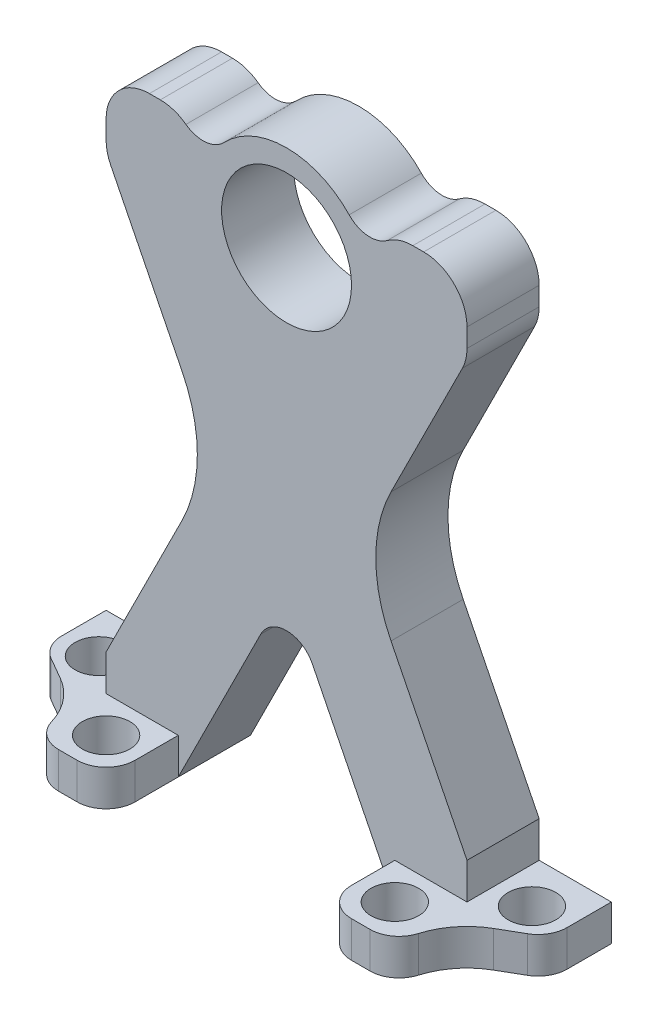
from build123d import *

# Parameters (mm, degrees)
SKETCH1_R           = 4.5
BOSS_EXTRUDE2_DEPTH = 5
SKETCH2_W           = 5
SKETCH2_H           = 2.5
BOSS_EXTRUDE3_DEPTH = 10
SKETCH3_W           = 10
SKETCH3_H           = 2.5
BOSS_EXTRUDE4_DEPTH = 5
SKETCH4_W           = 10
SKETCH4_H           = 2.5
BOSS_EXTRUDE5_DEPTH = 5
SKETCH5_R           = 1.65
CUT_EXTRUDE1_DEPTH  = 5
CHAMFER1_SIZE       = 5.773502692
CHAMFER1_SIZE_2     = 10
FILLET1_R           = 2
FILLET2_R           = 5
FILLET3_R           = 2
FILLET4_R           = 2
FILLET5_R           = 10
FILLET6_R           = 3
SKETCH6_R           = 1.65
SKETCH6_W           = 36.073404507
SKETCH6_H           = 7.954648173
CUT_EXTRUDE2_DEPTH  = 5
FILLET10_R          = 2


with BuildPart() as part:
    # Sketch1 → Boss-Extrude2 (new body)
    with BuildSketch(Plane.XY):
        with BuildLine():
            Line((-7.5, 20), (-5.870329309, 16.740658618))
            ThreePointArc((-5.870329309, 16.740658618), (0, 21.5), (5.870329309, 16.740658618))
            Line((5.870329309, 16.740658618), (7.5, 20))
            Line((7.5, 20), (12.5, 20))
            Line((12.5, 20), (12.5, 15))
            Line((12.5, 15), (5, 0))
            Line((5, 0), (12.5, -15))
            Line((12.5, -15), (12.5, -20))
            Line((12.5, -20), (7.5, -20))
            Line((7.5, -20), (0, -5))
            Line((0, -5), (-7.5, -20))
            Line((-7.5, -20), (-12.5, -20))
            Line((-12.5, -20), (-12.5, -15))
            Line((-12.5, -15), (-5, 0))
            Line((-5, 0), (-12.5, 15))
            Line((-12.5, 15), (-12.5, 20))
            Line((-12.5, 20), (-7.5, 20))
        make_face()
        with Locations((0, 15.5)):
            Circle(SKETCH1_R, mode=Mode.SUBTRACT)
    extrude(amount=BOSS_EXTRUDE2_DEPTH)

    # Sketch2 → Boss-Extrude3 (add)
    with BuildSketch(Plane.XY.offset(5)):
        with Locations((-10, -18.75)):
            Rectangle(SKETCH2_W, SKETCH2_H)
        with Locations((10, -18.75)):
            Rectangle(SKETCH2_W, SKETCH2_H)
    extrude(amount=BOSS_EXTRUDE3_DEPTH)

    # Sketch3 → Boss-Extrude4 (add)
    with BuildSketch(Plane(origin=(12.5, 0, 0), x_dir=(0, 0, -1), z_dir=(1, 0, 0))):
        with Locations((-5, -18.75)):
            Rectangle(SKETCH3_W, SKETCH3_H)
    extrude(amount=BOSS_EXTRUDE4_DEPTH)

    # Sketch4 → Boss-Extrude5 (add)
    with BuildSketch(Plane.ZY.offset(12.5)):
        with Locations((5, -18.75)):
            Rectangle(SKETCH4_W, SKETCH4_H)
    extrude(amount=BOSS_EXTRUDE5_DEPTH)

    # Sketch5 → Cut-Extrude1 (cut)
    with BuildSketch(Plane(origin=(0, -17.5, 0), x_dir=(1, 0, 0), z_dir=(0, 1, 0))):
        with Locations(Location((-15, -3, 0), (0, 0, 270))):
            Circle(SKETCH5_R)
        with Locations(Location((-10, -12, 0), (0, 0, 270))):
            Circle(SKETCH5_R)
        with Locations(Location((10, -12, 0), (0, 0, 270))):
            Circle(SKETCH5_R)
        with Locations(Location((15, -3, 0), (0, 0, 270))):
            Circle(SKETCH5_R)
    extrude(amount=-CUT_EXTRUDE1_DEPTH, mode=Mode.SUBTRACT)

    # Chamfer1
    # the kernel refuses this chamfer: 10, 5.773502692 mm, written as the material it takes off along each edge
    with BuildSketch(Plane(origin=(17.5, -45.870857546, 10), x_dir=(0.05789386240267053, 0, -0.9983227437537926), z_dir=(0, 1, 0))) as chamfer1_piece_1_section:
        Polygon((CHAMFER1_SIZE * 0.998322743736, CHAMFER1_SIZE * 0.0578938624016), (-CHAMFER1_SIZE_2 * 0.0578938624027, CHAMFER1_SIZE_2 * 0.998322743754), (0, 0), align=None)
    chamfer1_piece_1 = extrude(amount=54.241715093, mode=Mode.PRIVATE)
    chamfer1_piece_1 = split(chamfer1_piece_1, bisect_by=Plane(origin=(12.5, -18.75, 7.760588383), z_dir=(1, 0, 0)), keep=Keep.TOP, mode=Mode.PRIVATE)
    add(chamfer1_piece_1, mode=Mode.SUBTRACT)
    with BuildSketch(Plane(origin=(-17.5, -45.870857546, 10), x_dir=(-0.05789386240267053, 0, -0.9983227437537926), z_dir=(0, 1, 0))) as chamfer1_piece_2_section:
        Polygon((CHAMFER1_SIZE * 0.998322743736, -CHAMFER1_SIZE * 0.0578938624016), (-CHAMFER1_SIZE_2 * 0.0578938624027, -CHAMFER1_SIZE_2 * 0.998322743754), (0, 0), align=None)
    chamfer1_piece_2 = extrude(amount=54.241715093, mode=Mode.PRIVATE)
    chamfer1_piece_2 = split(chamfer1_piece_2, bisect_by=Plane(origin=(-12.5, -18.75, 7.760588383), z_dir=(-1, 0, 0)), keep=Keep.TOP, mode=Mode.PRIVATE)
    add(chamfer1_piece_2, mode=Mode.SUBTRACT)

    # Fillet1
    fillet1_edges = [part.edges().sort_by_distance(p)[0] for p in [
        (12.5, -18.75, 15),
        (7.5, -18.75, 15),
        (-7.5, -18.75, 15),
        (-12.5, -18.75, 15),
    ]]
    fillet(fillet1_edges, radius=FILLET1_R)

    # Fillet2
    fillet2_edges = [part.edges().sort_by_distance(p)[0] for p in [
        (12.5, -18.75, 7.113248654),
        (-12.5, -18.75, 7.113248654),
    ]]
    fillet(fillet2_edges, radius=FILLET2_R)

    # Fillet3
    fillet3_edges = [part.edges().sort_by_distance(p)[0] for p in [
        (17.5, -18.75, 4.226497308),
        (-17.5, -18.75, 4.226497308),
    ]]
    fillet(fillet3_edges, radius=FILLET3_R)

    # Fillet4
    # the kernel refuses this fillet: 2 mm, written as the material it adds along each edge
    with BuildSketch(Plane(origin=(-5.870329309, 16.740658618, 0), x_dir=(-0.4472135954999439, 0.894427190999923, 0), z_dir=(0, 0, 1))) as fillet4_piece_1:
        with BuildLine():
            CenterArc((3.795112325, -1.99428722), FILLET4_R, 94.331614503, 105.404093699)
            Line((1.912591774, -2.669651103), (1.874941363, -2.683158381))
            ThreePointArc((1.874941363, -2.683158381), (1.109985705, -1.224719073), (-0.024899799, -0.031304952))
            Line((-0.024899799, -0.031304952), (0, 0.04))
            ThreePointArc((0, 0.04), (1.822027223, 0.04), (3.641033289, 0.039885744))
            Line((3.641033289, 0.039885744), (3.644054446, 0))
        make_face()
    extrude(amount=5)
    with BuildSketch(Plane(origin=(5.870329309, 16.740658618, 0), x_dir=(-0.46663943526551355, 0.8844476454008358, 0), z_dir=(0, 0, 1))) as fillet4_piece_2:
        with BuildLine():
            CenterArc((3.831402307, -1.923646391), FILLET4_R, 105.88286544, 105.404093699)
            Line((2.1222482, -2.962295628), (2.088065118, -2.983068612))
            ThreePointArc((2.088065118, -2.983068612), (1.02860762, -1.504443275), (-0.03251648, -0.023295461))
            Line((-0.03251648, -0.023295461), (0.010946864, 0.038472928))
            ThreePointArc((0.010946864, 0.038472928), (1.64202956, -0.189060828), (3.273112257, 0.038472928))
            Line((3.273112257, 0.038472928), (3.284059121, 0))
        make_face()
    extrude(amount=5)
    with BuildSketch(Plane(origin=(0, -5, 0), x_dir=(-0.4472135954999584, -0.8944271909999157, 0), z_dir=(0, 0, 1))) as fillet4_piece_3:
        with BuildLine():
            CenterArc((FILLET4_R * 2, FILLET4_R), FILLET4_R, 143.130102354, 126.869897646)
            Line((FILLET4_R * 1.2, FILLET4_R * 1.6), (FILLET4_R * 1.184, FILLET4_R * 1.612))
            Line((FILLET4_R * 1.184, FILLET4_R * 1.612), (-FILLET4_R * 0.016, FILLET4_R * 0.012))
            Line((-FILLET4_R * 0.016, FILLET4_R * 0.012), (0, -FILLET4_R * 0.02))
            Line((0, -FILLET4_R * 0.02), (FILLET4_R * 2, -FILLET4_R * 0.02))
            Line((FILLET4_R * 2, -FILLET4_R * 0.02), (FILLET4_R * 2, 0))
        make_face()
    extrude(amount=5)

    # Fillet5
    fillet5_edges = [part.edges().sort_by_distance(p)[0] for p in [
        (5, 0, 2.5),
        (-5, 0, 2.5),
    ]]
    fillet(fillet5_edges, radius=FILLET5_R)

    # Fillet6
    fillet6_edges = [part.edges().sort_by_distance(p)[0] for p in [
        (7.5, 20, 2.5),
        (12.5, 20, 2.5),
        (12.5, 15, 2.5),
        (-12.5, 15, 2.5),
        (-12.5, 20, 2.5),
        (-7.5, 20, 2.5),
    ]]
    fillet(fillet6_edges, radius=FILLET6_R)

    # Sketch6 → Cut-Extrude2 (cut)
    with BuildSketch(Plane(origin=(0, -17.5, 0), x_dir=(1, 0, 0), z_dir=(0, 1, 0))):
        with Locations(Location((-10, -7.5, 0), (0, 0, 270))):
            Circle(SKETCH6_R)
        with Locations(Location((10, -7.5, 0), (0, 0, 270))):
            Circle(SKETCH6_R)
        with Locations((1.341190681, -13.977324087)):
            Rectangle(SKETCH6_W, SKETCH6_H)
    extrude(amount=-CUT_EXTRUDE2_DEPTH, mode=Mode.SUBTRACT)

    # Fillet10
    fillet10_edges = [part.edges().sort_by_distance(p)[0] for p in [
        (12.5, -18.75, 10),
        (-12.5, -18.75, 10),
        (7.5, -18.75, 10),
        (-7.5, -18.75, 10),
    ]]
    fillet(fillet10_edges, radius=FILLET10_R)


solid = part.part
